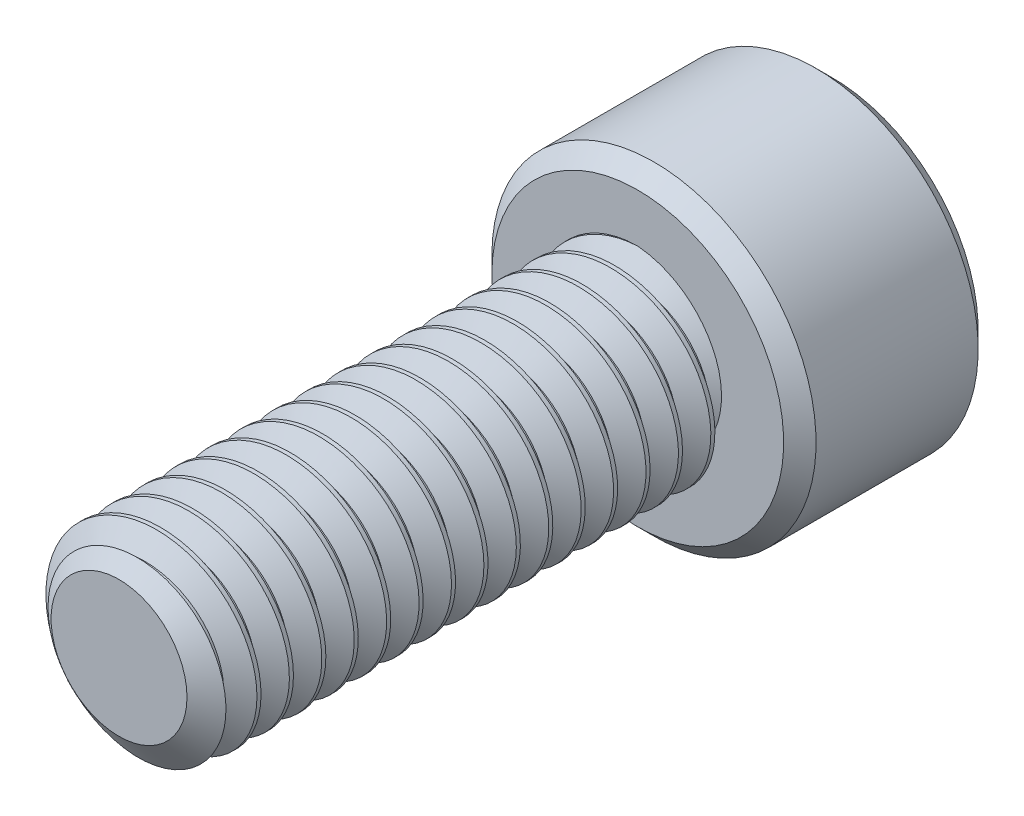
from build123d import *

# Parameters (mm, degrees)
SKETCH1_R          = 3
EXTRUDE1_DEPTH     = 16
CUT_SWEEP1_PITCH   = 1
SKETCH6_R          = 5
EXTRUDE2_DEPTH     = 6
CUT_EXTRUDE1_DEPTH = 3.75
CHAMFER1_SIZE      = 0.5


with BuildPart() as part:
    # Sketch1 → Extrude1 (new body)
    with BuildSketch(Plane.XY):
        Circle(SKETCH1_R)
    extrude(amount=-EXTRUDE1_DEPTH)

    # Cut-Sweep1: the profile of Sketch3 profile screwed along a right-hand helix of 17 turns, 6 arcs to a turn; built about Z, then put on its axis
    cut_sweep1_z = Axis((0, 0, 0), (0, 0, 1))
    cut_sweep1_corners = [(3.0003, 0, -0.875173205), (2.350480947, 0, -0.5), (2.350480947, 0, -0.375), (3.0003, 0, 0.000173205)]
    with BuildLine(mode=Mode.PRIVATE) as cut_sweep1_profile:
        Line(cut_sweep1_corners[0], cut_sweep1_corners[1])
        Line(cut_sweep1_corners[1], cut_sweep1_corners[2])
        Line(cut_sweep1_corners[2], cut_sweep1_corners[3])
        Line(cut_sweep1_corners[3], cut_sweep1_corners[0])
    cut_sweep1_cap = Face(cut_sweep1_profile.wire())
    cut_sweep1_turn_angles = [0, 30, 60, 90, 120, 150, 180, 210, 240, 270, 300, 330, 360]
    cut_sweep1_turn_weights = [1, 0.8660254037844387, 1, 0.8660254037844387, 1, 0.8660254037844387, 1, 0.8660254037844387, 1, 0.8660254037844387, 1, 0.8660254037844387, 1]
    cut_sweep1_turn_rails = [Edge.make_bspline([Vector(p[0], p[1], 0).rotate(cut_sweep1_z, cut_sweep1_turn_angles[k]) / cut_sweep1_turn_weights[k] + Vector(0, 0, p[2] + CUT_SWEEP1_PITCH * cut_sweep1_turn_angles[k] / 360) for k in range(13)], [0, 0, 0, 1, 1, 2, 2, 3, 3, 4, 4, 5, 5, 6, 6, 6], 2, cut_sweep1_turn_weights) for p in cut_sweep1_corners]
    cut_sweep1_turn_sides = [Face.make_surface_from_curves(cut_sweep1_turn_rails[p[0]], cut_sweep1_turn_rails[p[1]]) for p in [(0, 1), (1, 2), (2, 3), (3, 0)]]
    cut_sweep1 = Plane(origin=(0, 0, 0), x_dir=(0, 1, 0), z_dir=(0, 0, -1)) * Solid(Shell([*[p.moved(Location((0, 0, CUT_SWEEP1_PITCH * i))) for i in range(17) for p in cut_sweep1_turn_sides], cut_sweep1_cap, cut_sweep1_cap.rotate(cut_sweep1_z, 6120).moved(Location((0, 0, CUT_SWEEP1_PITCH * 6120 / 360)))]))
    add(cut_sweep1, mode=Mode.SUBTRACT)

    # Sketch4 → Cut-Revolve1 (revolve, cut)
    with BuildSketch(Plane(origin=(0, 0, 0), x_dir=(0, 0, -1), z_dir=(1, 0, 0)), mode=Mode.PRIVATE) as cut_revolve1_sk:
        Polygon((0.632650852, 3), (0, 2.096480947), (0, 3), align=None)
    revolve(cut_revolve1_sk.sketch.rotate(Axis((0, 0, 0), (0, 0, -1)), 270), axis=Axis((0, 0, 0), (0, 0, -1)), mode=Mode.SUBTRACT)

    # Sketch6 → Extrude2 (add)
    with BuildSketch(Plane(origin=(0, 0, -16), x_dir=(-1, 0, 0), z_dir=(0, 0, -1))):
        Circle(SKETCH6_R)
    extrude(amount=EXTRUDE2_DEPTH)

    # Sketch7 → Cut-Extrude1 (cut)
    with BuildSketch(Plane(origin=(0, 0, -22), x_dir=(-1, 0, 0), z_dir=(0, 0, -1))):
        Polygon((0, 2.886751346), (-2.5, 1.443375673), (-2.5, -1.443375673), (0, -2.886751346), (2.5, -1.443375673), (2.5, 1.443375673), align=None)
    extrude(amount=-CUT_EXTRUDE1_DEPTH, mode=Mode.SUBTRACT)

    # Cut-Extrude2 cone 1 section (through the dimple's axis) → Cut-Extrude2 (revolve, cut)
    with BuildSketch(Plane(origin=(0, 0, -22), x_dir=(0, 1, 0), z_dir=(1, 0, 0))):
        Polygon((0, 0), (2.886751346, 0), (0, 2.886751346), align=None)
    revolve(axis=Axis((0, 0, -22), (0, 0, 1)), mode=Mode.SUBTRACT)

    # Chamfer1
    chamfer1_edges = [part.edges().sort_by_distance(p)[0] for p in [
        (5, 0, -16),
        (5, 0, -22),
    ]]
    chamfer(chamfer1_edges, length=CHAMFER1_SIZE)


solid = part.part
